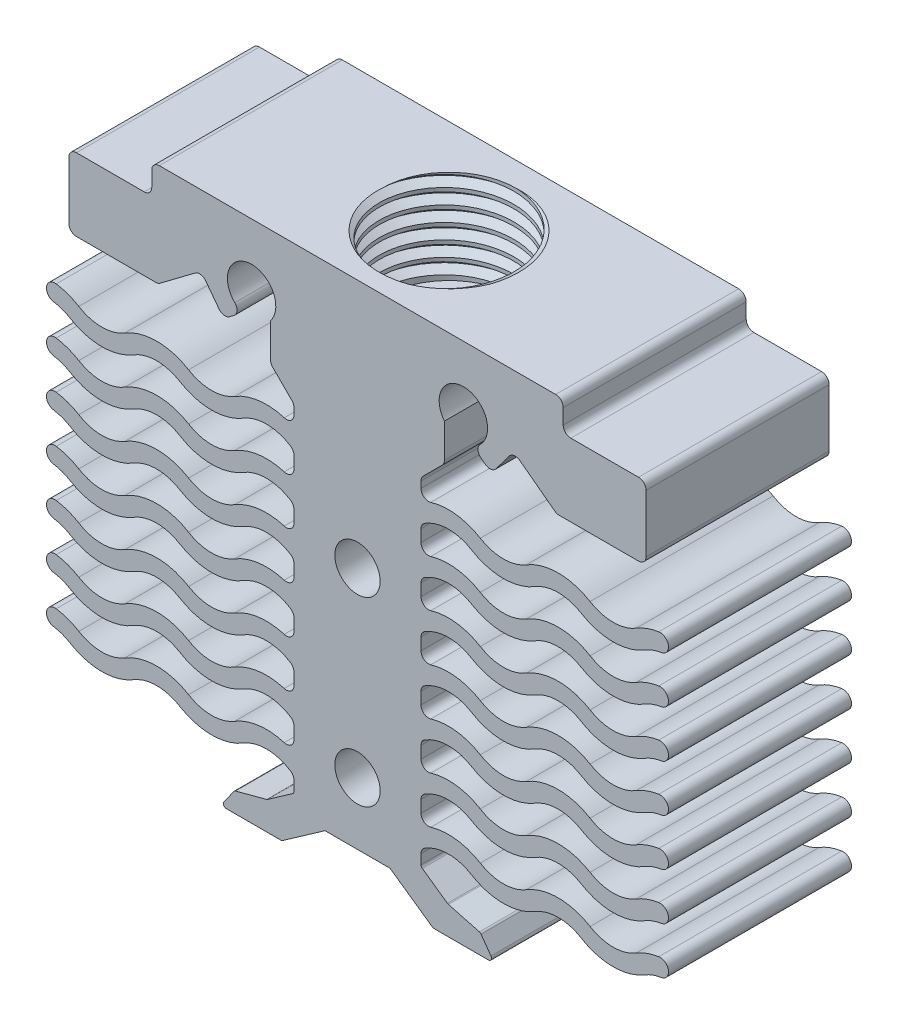
from build123d import *

# Parameters (mm, degrees)
BODY_DEPTH               = 6.05
BODY_DEPTH_BACK          = 6.05
MOUNT_HOLES_DEPTH        = 40.972601867
MOUNT_HOLES_DEPTH_BACK   = 40.972601867
MOUNT_SKETCH_R           = 1.6
BLADE_DEPTH              = 6.05
BLADES_ARRAY_COUNT       = 7
BLADES_ARRAY_PITCH       = 3.1
MIRROR_2_COPY_1_DEPTH    = 6.05
MIRROR_2_COPY_2_DEPTH    = 6.05
MIRROR_2_COPY_3_DEPTH    = 6.05
MIRROR_2_COPY_4_DEPTH    = 6.05
MIRROR_2_COPY_5_DEPTH    = 6.05
MIRROR_2_COPY_6_DEPTH    = 6.05
FITING_SKETCH_R          = 4.45
FITING_THTEAD_DEPTH      = 6.2
THERMOBREAK_HOLE_REACH   = 42.7
THERMOBREAK_SKETCH_R     = 3.05
RETAINING_SKETCH_R       = 1.5
RETAINING_HOLES_DEPTH    = 41.699829238
ROUNDING1_R              = 0.5
ROUNDING2_R              = 0.5
ROUNDING3_R              = 0.2
HEATER_MOUNT_HOLES_REACH = 42.7
HEATER_MOUNT_SKETCH_R    = 1
THREAD_PITCH             = 1
THREAD_TO                = 7.2


with BuildPart() as part:
    # body sketch → body (new, two sides: drawn at the far end of the back side and taken through both)
    with BuildSketch(Plane.XY.offset(-BODY_DEPTH_BACK)):
        Polygon((-13.6, 0), (13.6, 0), (13.6, -2), (19.08, -2), (19.08, -6.8), (13.174631275, -6.8), (10.333011108, -4.6639883), (8.855784757, -6.629200472), (7.580717064, -5.670747424), (8.412424213, -4.564294772), (6.939696904, -3.457263369), (5.75, -5.039963836), (5.75, -7.647960933), (4.2, -9.197960933), (4.2, -31.482959922), (5.97596634, -32.729252091), (8.127436149, -33.304189363), (9.05, -34.6), (5, -34.6), (2.15, -32.6), (-2.15, -32.6), (-5, -34.6), (-9.05, -34.6), (-8.127436149, -33.304189363), (-5.97596634, -32.729252091), (-4.2, -31.482959922), (-4.2, -9.197960933), (-5.75, -7.647960933), (-5.75, -5.039963836), (-6.939696904, -3.457263369), (-8.412424213, -4.564294772), (-7.580717064, -5.670747424), (-8.855784757, -6.629200472), (-10.333011108, -4.6639883), (-13.174631275, -6.8), (-19.08, -6.8), (-19.08, -2), (-13.6, -2), align=None)
    extrude(amount=BODY_DEPTH + BODY_DEPTH_BACK)

    # mount sketch → mount holes (cut, two sides: drawn at the far end of the back side and taken through both)
    with BuildSketch(Plane.XY.offset(-MOUNT_HOLES_DEPTH_BACK)):
        with Locations((-7, -4.2)):
            Circle(MOUNT_SKETCH_R)
        with Locations((7, -4.2)):
            Circle(MOUNT_SKETCH_R)
    extrude(amount=MOUNT_HOLES_DEPTH + MOUNT_HOLES_DEPTH_BACK, mode=Mode.SUBTRACT)

    # blades sketch → blade (add, symmetric)
    with BuildSketch(Plane.XY):
        with BuildLine():
            ThreePointArc((4.490253618, -11.678907963), (6.014085114, -11.25317477), (7.537916609, -11.678907963))
            ThreePointArc((7.537916609, -11.678907963), (9.642255341, -12.26682523), (11.746594072, -11.678907963))
            ThreePointArc((11.746594072, -11.678907963), (13.270425568, -11.25317477), (14.794257063, -11.678907963))
            ThreePointArc((14.794257063, -11.678907963), (16.898595795, -12.26682523), (19.002934527, -11.678907963))
            ThreePointArc((19.002934527, -11.678907963), (19.52423793, -11.429384361), (20.084282564, -11.286663392))
            ThreePointArc((20.084282564, -11.286663392), (20.553621215, -10.648759613), (19.915717436, -10.179420962))
            ThreePointArc((19.915717436, -10.179420962), (19.142322466, -10.376511824), (18.42242729, -10.721092037))
            ThreePointArc((18.42242729, -10.721092037), (16.898595795, -11.14682523), (15.3747643, -10.721092037))
            ThreePointArc((15.3747643, -10.721092037), (13.270425568, -10.13317477), (11.166086836, -10.721092037))
            ThreePointArc((11.166086836, -10.721092037), (9.642255341, -11.14682523), (8.118423845, -10.721092037))
            ThreePointArc((8.118423845, -10.721092037), (6.014085114, -10.13317477), (3.909746382, -10.721092037))
            ThreePointArc((3.909746382, -10.721092037), (3.721092037, -11.490253618), (4.490253618, -11.678907963))
        make_face()
    blade = extrude(amount=BLADE_DEPTH, both=True)

    # blades array: blade ×7
    with Locations(*[(0, -i * BLADES_ARRAY_PITCH, 0) for i in range(1, BLADES_ARRAY_COUNT)]):
        add(blade)

    # mirror 2: blade across plane
    add(blade.mirror(Plane(origin=(0, 0, 0), x_dir=(0, 0, 1), z_dir=(1, 0, 0))))

    # mirror 2 copy 1 sketch → mirror 2 copy 1 (add, symmetric)
    with BuildSketch(Plane(origin=(0, -3.1, 0), x_dir=(-1, 0, 0), z_dir=(0, 0, 1))):
        with BuildLine():
            ThreePointArc((4.490253618, 11.678907963), (6.014085114, 11.25317477), (7.537916609, 11.678907963))
            ThreePointArc((7.537916609, 11.678907963), (9.642255341, 12.26682523), (11.746594072, 11.678907963))
            ThreePointArc((11.746594072, 11.678907963), (13.270425568, 11.25317477), (14.794257063, 11.678907963))
            ThreePointArc((14.794257063, 11.678907963), (16.898595795, 12.26682523), (19.002934527, 11.678907963))
            ThreePointArc((19.002934527, 11.678907963), (19.52423793, 11.429384361), (20.084282564, 11.286663392))
            ThreePointArc((20.084282564, 11.286663392), (20.553621215, 10.648759613), (19.915717436, 10.179420962))
            ThreePointArc((19.915717436, 10.179420962), (19.142322466, 10.376511824), (18.42242729, 10.721092037))
            ThreePointArc((18.42242729, 10.721092037), (16.898595795, 11.14682523), (15.3747643, 10.721092037))
            ThreePointArc((15.3747643, 10.721092037), (13.270425568, 10.13317477), (11.166086836, 10.721092037))
            ThreePointArc((11.166086836, 10.721092037), (9.642255341, 11.14682523), (8.118423845, 10.721092037))
            ThreePointArc((8.118423845, 10.721092037), (6.014085114, 10.13317477), (3.909746382, 10.721092037))
            ThreePointArc((3.909746382, 10.721092037), (3.721092037, 11.490253618), (4.490253618, 11.678907963))
        make_face()
    extrude(amount=MIRROR_2_COPY_1_DEPTH, both=True)

    # mirror 2 copy 2 sketch → mirror 2 copy 2 (add, symmetric)
    with BuildSketch(Plane(origin=(0, -6.2, 0), x_dir=(-1, 0, 0), z_dir=(0, 0, 1))):
        with BuildLine():
            ThreePointArc((4.490253618, 11.678907963), (6.014085114, 11.25317477), (7.537916609, 11.678907963))
            ThreePointArc((7.537916609, 11.678907963), (9.642255341, 12.26682523), (11.746594072, 11.678907963))
            ThreePointArc((11.746594072, 11.678907963), (13.270425568, 11.25317477), (14.794257063, 11.678907963))
            ThreePointArc((14.794257063, 11.678907963), (16.898595795, 12.26682523), (19.002934527, 11.678907963))
            ThreePointArc((19.002934527, 11.678907963), (19.52423793, 11.429384361), (20.084282564, 11.286663392))
            ThreePointArc((20.084282564, 11.286663392), (20.553621215, 10.648759613), (19.915717436, 10.179420962))
            ThreePointArc((19.915717436, 10.179420962), (19.142322466, 10.376511824), (18.42242729, 10.721092037))
            ThreePointArc((18.42242729, 10.721092037), (16.898595795, 11.14682523), (15.3747643, 10.721092037))
            ThreePointArc((15.3747643, 10.721092037), (13.270425568, 10.13317477), (11.166086836, 10.721092037))
            ThreePointArc((11.166086836, 10.721092037), (9.642255341, 11.14682523), (8.118423845, 10.721092037))
            ThreePointArc((8.118423845, 10.721092037), (6.014085114, 10.13317477), (3.909746382, 10.721092037))
            ThreePointArc((3.909746382, 10.721092037), (3.721092037, 11.490253618), (4.490253618, 11.678907963))
        make_face()
    extrude(amount=MIRROR_2_COPY_2_DEPTH, both=True)

    # mirror 2 copy 3 sketch → mirror 2 copy 3 (add, symmetric)
    with BuildSketch(Plane(origin=(0, -9.3, 0), x_dir=(-1, 0, 0), z_dir=(0, 0, 1))):
        with BuildLine():
            ThreePointArc((4.490253618, 11.678907963), (6.014085114, 11.25317477), (7.537916609, 11.678907963))
            ThreePointArc((7.537916609, 11.678907963), (9.642255341, 12.26682523), (11.746594072, 11.678907963))
            ThreePointArc((11.746594072, 11.678907963), (13.270425568, 11.25317477), (14.794257063, 11.678907963))
            ThreePointArc((14.794257063, 11.678907963), (16.898595795, 12.26682523), (19.002934527, 11.678907963))
            ThreePointArc((19.002934527, 11.678907963), (19.52423793, 11.429384361), (20.084282564, 11.286663392))
            ThreePointArc((20.084282564, 11.286663392), (20.553621215, 10.648759613), (19.915717436, 10.179420962))
            ThreePointArc((19.915717436, 10.179420962), (19.142322466, 10.376511824), (18.42242729, 10.721092037))
            ThreePointArc((18.42242729, 10.721092037), (16.898595795, 11.14682523), (15.3747643, 10.721092037))
            ThreePointArc((15.3747643, 10.721092037), (13.270425568, 10.13317477), (11.166086836, 10.721092037))
            ThreePointArc((11.166086836, 10.721092037), (9.642255341, 11.14682523), (8.118423845, 10.721092037))
            ThreePointArc((8.118423845, 10.721092037), (6.014085114, 10.13317477), (3.909746382, 10.721092037))
            ThreePointArc((3.909746382, 10.721092037), (3.721092037, 11.490253618), (4.490253618, 11.678907963))
        make_face()
    extrude(amount=MIRROR_2_COPY_3_DEPTH, both=True)

    # mirror 2 copy 4 sketch → mirror 2 copy 4 (add, symmetric)
    with BuildSketch(Plane(origin=(0, -12.4, 0), x_dir=(-1, 0, 0), z_dir=(0, 0, 1))):
        with BuildLine():
            ThreePointArc((4.490253618, 11.678907963), (6.014085114, 11.25317477), (7.537916609, 11.678907963))
            ThreePointArc((7.537916609, 11.678907963), (9.642255341, 12.26682523), (11.746594072, 11.678907963))
            ThreePointArc((11.746594072, 11.678907963), (13.270425568, 11.25317477), (14.794257063, 11.678907963))
            ThreePointArc((14.794257063, 11.678907963), (16.898595795, 12.26682523), (19.002934527, 11.678907963))
            ThreePointArc((19.002934527, 11.678907963), (19.52423793, 11.429384361), (20.084282564, 11.286663392))
            ThreePointArc((20.084282564, 11.286663392), (20.553621215, 10.648759613), (19.915717436, 10.179420962))
            ThreePointArc((19.915717436, 10.179420962), (19.142322466, 10.376511824), (18.42242729, 10.721092037))
            ThreePointArc((18.42242729, 10.721092037), (16.898595795, 11.14682523), (15.3747643, 10.721092037))
            ThreePointArc((15.3747643, 10.721092037), (13.270425568, 10.13317477), (11.166086836, 10.721092037))
            ThreePointArc((11.166086836, 10.721092037), (9.642255341, 11.14682523), (8.118423845, 10.721092037))
            ThreePointArc((8.118423845, 10.721092037), (6.014085114, 10.13317477), (3.909746382, 10.721092037))
            ThreePointArc((3.909746382, 10.721092037), (3.721092037, 11.490253618), (4.490253618, 11.678907963))
        make_face()
    extrude(amount=MIRROR_2_COPY_4_DEPTH, both=True)

    # mirror 2 copy 5 sketch → mirror 2 copy 5 (add, symmetric)
    with BuildSketch(Plane(origin=(0, -15.5, 0), x_dir=(-1, 0, 0), z_dir=(0, 0, 1))):
        with BuildLine():
            ThreePointArc((4.490253618, 11.678907963), (6.014085114, 11.25317477), (7.537916609, 11.678907963))
            ThreePointArc((7.537916609, 11.678907963), (9.642255341, 12.26682523), (11.746594072, 11.678907963))
            ThreePointArc((11.746594072, 11.678907963), (13.270425568, 11.25317477), (14.794257063, 11.678907963))
            ThreePointArc((14.794257063, 11.678907963), (16.898595795, 12.26682523), (19.002934527, 11.678907963))
            ThreePointArc((19.002934527, 11.678907963), (19.52423793, 11.429384361), (20.084282564, 11.286663392))
            ThreePointArc((20.084282564, 11.286663392), (20.553621215, 10.648759613), (19.915717436, 10.179420962))
            ThreePointArc((19.915717436, 10.179420962), (19.142322466, 10.376511824), (18.42242729, 10.721092037))
            ThreePointArc((18.42242729, 10.721092037), (16.898595795, 11.14682523), (15.3747643, 10.721092037))
            ThreePointArc((15.3747643, 10.721092037), (13.270425568, 10.13317477), (11.166086836, 10.721092037))
            ThreePointArc((11.166086836, 10.721092037), (9.642255341, 11.14682523), (8.118423845, 10.721092037))
            ThreePointArc((8.118423845, 10.721092037), (6.014085114, 10.13317477), (3.909746382, 10.721092037))
            ThreePointArc((3.909746382, 10.721092037), (3.721092037, 11.490253618), (4.490253618, 11.678907963))
        make_face()
    extrude(amount=MIRROR_2_COPY_5_DEPTH, both=True)

    # mirror 2 copy 6 sketch → mirror 2 copy 6 (add, symmetric)
    with BuildSketch(Plane(origin=(0, -18.6, 0), x_dir=(-1, 0, 0), z_dir=(0, 0, 1))):
        with BuildLine():
            ThreePointArc((4.490253618, 11.678907963), (6.014085114, 11.25317477), (7.537916609, 11.678907963))
            ThreePointArc((7.537916609, 11.678907963), (9.642255341, 12.26682523), (11.746594072, 11.678907963))
            ThreePointArc((11.746594072, 11.678907963), (13.270425568, 11.25317477), (14.794257063, 11.678907963))
            ThreePointArc((14.794257063, 11.678907963), (16.898595795, 12.26682523), (19.002934527, 11.678907963))
            ThreePointArc((19.002934527, 11.678907963), (19.52423793, 11.429384361), (20.084282564, 11.286663392))
            ThreePointArc((20.084282564, 11.286663392), (20.553621215, 10.648759613), (19.915717436, 10.179420962))
            ThreePointArc((19.915717436, 10.179420962), (19.142322466, 10.376511824), (18.42242729, 10.721092037))
            ThreePointArc((18.42242729, 10.721092037), (16.898595795, 11.14682523), (15.3747643, 10.721092037))
            ThreePointArc((15.3747643, 10.721092037), (13.270425568, 10.13317477), (11.166086836, 10.721092037))
            ThreePointArc((11.166086836, 10.721092037), (9.642255341, 11.14682523), (8.118423845, 10.721092037))
            ThreePointArc((8.118423845, 10.721092037), (6.014085114, 10.13317477), (3.909746382, 10.721092037))
            ThreePointArc((3.909746382, 10.721092037), (3.721092037, 11.490253618), (4.490253618, 11.678907963))
        make_face()
    extrude(amount=MIRROR_2_COPY_6_DEPTH, both=True)

    # fiting sketch → fiting thtead (cut)
    with BuildSketch(Plane(origin=(0, 0, 0), x_dir=(1, 0, 0), z_dir=(0, 1, 0))):
        with Locations(Location((0, 0, 0), (0, 0, 270))):
            Circle(FITING_SKETCH_R)
    extrude(amount=-FITING_THTEAD_DEPTH, mode=Mode.SUBTRACT)

    # thermobreak sketch → thermobreak hole (cut, up to next)
    with BuildSketch(Plane(origin=(0, 0, 0), x_dir=(1, 0, 0), z_dir=(0, 1, 0)), mode=Mode.PRIVATE) as thermobreak_hole_sk1:
        with Locations(Location((0, 0, 0), (0, 0, 270))):
            Circle(THERMOBREAK_SKETCH_R)
    thermobreak_hole_tool1 = extrude(thermobreak_hole_sk1.sketch, amount=-THERMOBREAK_HOLE_REACH, mode=Mode.PRIVATE) & part.part
    add(thermobreak_hole_tool1.solids().sort_by_distance((0, 0, 0))[0], mode=Mode.SUBTRACT)

    # retaining sketch → retaining holes (cut, through all)
    with BuildSketch(Plane.XY):
        with Locations(Location((0, -16.5, 0), (0, 0, 270))):
            Circle(RETAINING_SKETCH_R)
        with Locations(Location((0, -28.5, 0), (0, 0, 270))):
            Circle(RETAINING_SKETCH_R)
    extrude(amount=RETAINING_HOLES_DEPTH, mode=Mode.SUBTRACT)

    # rounding1
    rounding1_edges = [part.edges().sort_by_distance(p)[0] for p in [
        (-7.598267046, -5.683939534, 0),
        (7.598267046, -5.683939534, 0),
        (13.6, -2, 0),
        (19.08, -2, 0),
        (19.08, -6.8, 0),
        (13.174631275, -6.8, 0),
        (10.333011108, -4.6639883, 0),
        (8.855784757, -6.629200472, 0),
        (5.75, -7.647960933, 0),
        (4.2, -9.197960933, 0),
        (-4.2, -9.197960933, 0),
        (-5.75, -7.647960933, 0),
        (-8.855784757, -6.629200472, 0),
        (-10.333011108, -4.6639883, 0),
        (-13.174631275, -6.8, 0),
        (-19.08, -6.8, 0),
        (-19.08, -2, 0),
        (-13.6, -2, 0),
        (-13.6, 0, 0),
        (13.6, 0, 0),
    ]]
    fillet(rounding1_edges, radius=ROUNDING1_R)

    # rounding2
    rounding2_edges = [part.edges().sort_by_distance(p)[0] for p in [
        (4.2, -11.76, 0),
        (4.2, -10.560999774, 0),
        (4.2, -14.86, 0),
        (4.2, -13.660999774, 0),
        (4.2, -17.96, 0),
        (4.2, -16.760999774, 0),
        (4.2, -21.06, 0),
        (4.2, -19.860999774, 0),
        (4.2, -24.16, 0),
        (4.2, -22.960999774, 0),
        (4.2, -27.26, 0),
        (4.2, -26.060999774, 0),
        (4.2, -30.36, 0),
        (4.2, -29.160999774, 0),
        (-4.2, -11.76, 0),
        (-4.2, -10.560999774, 0),
        (-4.2, -14.86, 0),
        (-4.2, -13.660999774, 0),
        (-4.2, -17.96, 0),
        (-4.2, -16.760999774, 0),
        (-4.2, -21.06, 0),
        (-4.2, -19.860999774, 0),
        (-4.2, -24.16, 0),
        (-4.2, -22.960999774, 0),
        (-4.2, -27.26, 0),
        (-4.2, -26.060999774, 0),
        (-4.2, -30.36, 0),
        (-4.2, -29.160999774, 0),
    ]]
    fillet(rounding2_edges, radius=ROUNDING2_R)

    # rounding3
    rounding3_edges = [part.edges().sort_by_distance(p)[0] for p in [
        (4.2, -31.482959922, 0),
        (5.97596634, -32.729252091, 0),
        (8.127436149, -33.304189363, 0),
        (9.05, -34.6, 0),
        (5, -34.6, 0),
        (-5, -34.6, 0),
        (-9.05, -34.6, 0),
        (-8.127436149, -33.304189363, 0),
        (-5.97596634, -32.729252091, 0),
        (-4.2, -31.482959922, 0),
    ]]
    fillet(rounding3_edges, radius=ROUNDING3_R)

    # heater mount sketch → heater mount holes (cut, up to next)
    with BuildSketch(Plane.XZ.offset(34.6), mode=Mode.PRIVATE) as heater_mount_holes_sk1:
        with Locations(Location((-7, 0, 0), (0, 0, 270))):
            Circle(HEATER_MOUNT_SKETCH_R)
    heater_mount_holes_tool1 = extrude(heater_mount_holes_sk1.sketch, amount=-HEATER_MOUNT_HOLES_REACH, mode=Mode.PRIVATE) & part.part
    # heater mount sketch → heater mount holes (cut, up to next)
    with BuildSketch(Plane.XZ.offset(34.6), mode=Mode.PRIVATE) as heater_mount_holes_sk2:
        with Locations(Location((7, 0, 0), (0, 0, 270))):
            Circle(HEATER_MOUNT_SKETCH_R)
    heater_mount_holes_tool2 = extrude(heater_mount_holes_sk2.sketch, amount=-HEATER_MOUNT_HOLES_REACH, mode=Mode.PRIVATE) & part.part
    add(heater_mount_holes_tool1.solids().sort_by_distance((-7, -34.6, 0))[0], mode=Mode.SUBTRACT)
    add(heater_mount_holes_tool2.solids().sort_by_distance((7, -34.6, 0))[0], mode=Mode.SUBTRACT)

    # thread: arcs per turn and ends read off the stored shape
    # thread: the profile of thread profile profile screwed along a right-hand helix through 7 turns, 8 arcs to a turn; built about Z, then put on its axis
    thread_z = Axis((0, 0, 0), (0, 0, 1))
    thread_corners = [(4.4497, 0, -0.000173205), (4.991265875, 0, 0.312499999), (4.991265875, 0, 0.437499999), (4.4497, 0, 0.750173202)]
    with BuildLine(mode=Mode.PRIVATE) as thread_profile:
        Line(thread_corners[0], thread_corners[1])
        Line(thread_corners[1], thread_corners[2])
        Line(thread_corners[2], thread_corners[3])
        Line(thread_corners[3], thread_corners[0])
    thread_cap = Face(thread_profile.wire())
    thread_turn_angles = [0, 22.5, 45, 67.5, 90, 112.5, 135, 157.5, 180, 202.5, 225, 247.5, 270, 292.5, 315, 337.5, 360]
    thread_turn_weights = [1, 0.9238795325112867, 1, 0.9238795325112867, 1, 0.9238795325112867, 1, 0.9238795325112867, 1, 0.9238795325112867, 1, 0.9238795325112867, 1, 0.9238795325112867, 1, 0.9238795325112867, 1]
    thread_turn_rails = [Edge.make_bspline([Vector(p[0], p[1], 0).rotate(thread_z, thread_turn_angles[k]) / thread_turn_weights[k] + Vector(0, 0, p[2] + THREAD_PITCH * thread_turn_angles[k] / 360) for k in range(17)], [0, 0, 0, 1, 1, 2, 2, 3, 3, 4, 4, 5, 5, 6, 6, 7, 7, 8, 8, 8], 2, thread_turn_weights) for p in thread_corners]
    thread_turn_sides = [Face.make_surface_from_curves(thread_turn_rails[p[0]], thread_turn_rails[p[1]]) for p in [(0, 1), (1, 2), (2, 3), (3, 0)]]
    thread = Plane(origin=(0, 1, 0), x_dir=(-1, 0, 0), z_dir=(0, -1, 0)) * split(Solid(Shell([*[p.moved(Location((0, 0, THREAD_PITCH * i))) for i in range(7) for p in thread_turn_sides], thread_cap, thread_cap.rotate(thread_z, 2520).moved(Location((0, 0, THREAD_PITCH * 2520 / 360)))])), bisect_by=Plane.XY.offset(THREAD_TO), keep=Keep.BOTTOM, mode=Mode.PRIVATE)
    add(thread, mode=Mode.SUBTRACT)


solid = part.part
